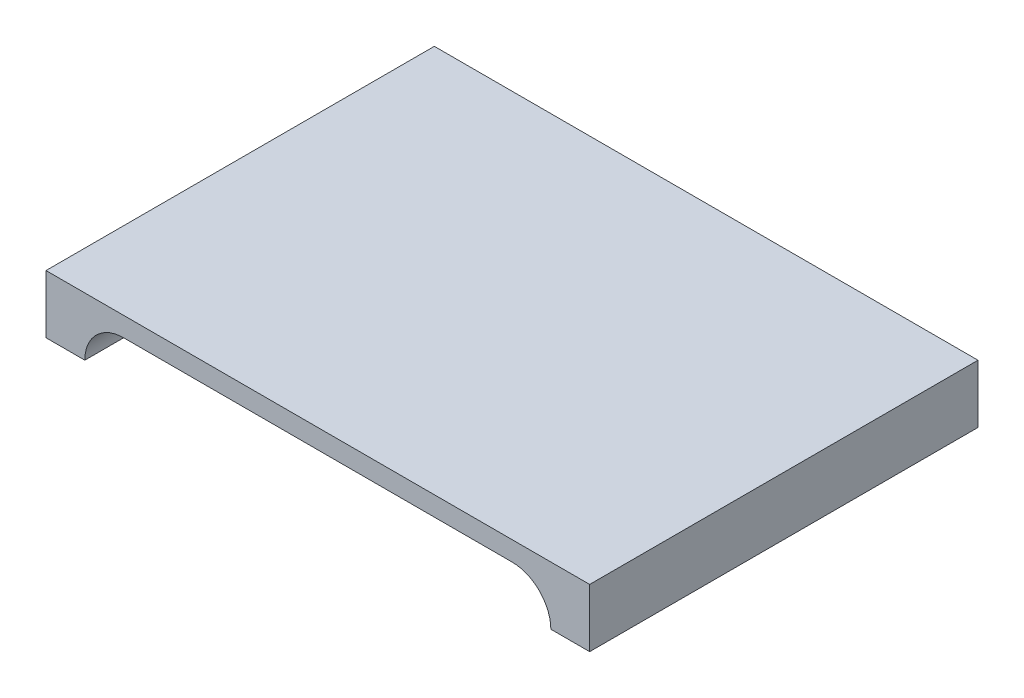
from build123d import *

# Parameters (mm, degrees)
STOCK_DECKMOLD_1_DEPTH = 457.2
SKETCH1_W              = 457.2
SKETCH1_H              = 76.2
BOSS_EXTRUDE1_DEPTH    = 50.8
SKETCH2_W              = 457.2
SKETCH2_H              = 76.2
BOSS_EXTRUDE2_DEPTH    = 50.8
BOSS_EXTRUDE4_DEPTH    = 25.4
BOSS_EXTRUDE5_START    = 25.4
BOSS_EXTRUDE5_DEPTH    = 25.4


# Read off the part's stored shape, not the designer's step: Stock-deckmold-1
with BuildPart() as part:
    # Stock-deckmold-1 outline → Stock-deckmold-1 (new body)
    with BuildSketch(Plane.XY):
        with BuildLine():
            Line((304.8, 25.4), (-304.8, 25.4))
            Line((-304.8, 25.4), (-304.8, -50.8))
            ThreePointArc((-304.8, -50.8), (-289.921024484, -14.878975516), (-254, 0))
            Line((-254, 0), (254, 0))
            ThreePointArc((254, 0), (289.921024484, -14.878975516), (304.8, -50.8))
            Line((304.8, -50.8), (304.8, 25.4))
        make_face()
    extrude(amount=STOCK_DECKMOLD_1_DEPTH)

    # Sketch1 → Boss-Extrude1 (add)
    with BuildSketch(Plane(origin=(304.8, 0, 0), x_dir=(0, 0, -1), z_dir=(1, 0, 0))):
        with Locations((-228.6, -12.7)):
            Rectangle(SKETCH1_W, SKETCH1_H)
    extrude(amount=BOSS_EXTRUDE1_DEPTH)

    # Sketch2 → Boss-Extrude2 (add)
    with BuildSketch(Plane.ZY.offset(304.8)):
        with Locations((228.6, -12.7)):
            Rectangle(SKETCH2_W, SKETCH2_H)
    extrude(amount=BOSS_EXTRUDE2_DEPTH)

    # Sketch3 → Boss-Extrude4 (add)
    with BuildSketch(Plane.XY.offset(457.2)):
        with BuildLine():
            Line((355.6, -50.8), (355.6, 25.4))
            Line((355.6, 25.4), (-355.6, 25.4))
            Line((-355.6, 25.4), (-355.6, -50.8))
            Line((-355.6, -50.8), (-304.8, -50.8))
            ThreePointArc((-304.8, -50.8), (-289.921024484, -14.878975516), (-254, 0))
            Line((-254, 0), (254, 0))
            ThreePointArc((254, 0), (289.921024484, -14.878975516), (304.8, -50.8))
            Line((304.8, -50.8), (355.6, -50.8))
        make_face()
    extrude(amount=BOSS_EXTRUDE4_DEPTH)

    # Sketch4 → Boss-Extrude5 (add)
    with BuildSketch(Plane(origin=(0, 0, 0), x_dir=(-1, 0, 0), z_dir=(0, 0, -1)).offset(BOSS_EXTRUDE5_START)):
        with BuildLine():
            Line((-254, 0), (254, 0))
            ThreePointArc((254, 0), (289.921024484, -14.878975516), (304.8, -50.8))
            Line((304.8, -50.8), (355.6, -50.8))
            Line((355.6, -50.8), (355.6, 25.4))
            Line((355.6, 25.4), (-355.6, 25.4))
            Line((-355.6, 25.4), (-355.6, -50.8))
            Line((-355.6, -50.8), (-304.8, -50.8))
            ThreePointArc((-304.8, -50.8), (-289.921024484, -14.878975516), (-254, 0))
        make_face()
    extrude(amount=-BOSS_EXTRUDE5_DEPTH)


solid = part.part
